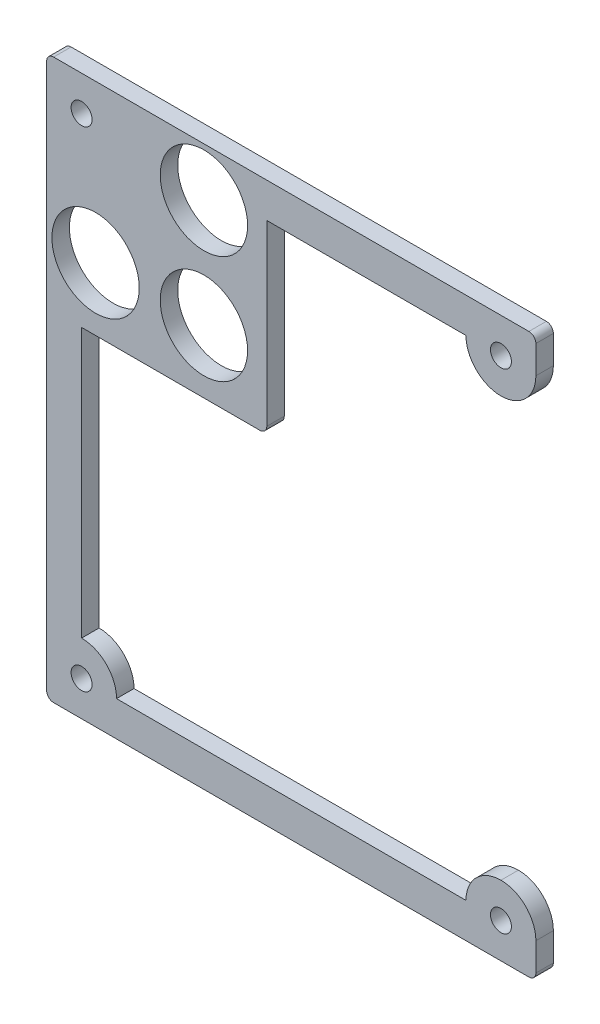
from build123d import *

# Parameters (mm, degrees)
MODEL_R             = 12.5
MODEL_R_2           = 3
BOSS_EXTRUDE2_DEPTH = 5
FILLET1_R           = 10
FILLET2_R           = 10


with BuildPart() as part:
    # Model → Boss-Extrude2 (new body)
    with BuildSketch(Plane.XY):
        with BuildLine():
            Line((140, 140), (140, 158))
            ThreePointArc((140, 158), (139.414213562, 159.414213562), (138, 160))
            Line((138, 160), (2, 160))
            ThreePointArc((2, 160), (0.585786438, 159.414213562), (0, 158))
            Line((0, 158), (0, 2))
            ThreePointArc((0, 2), (0.585786438, 0.585786438), (2, 0))
            Line((2, 0), (138, 0))
            ThreePointArc((138, 0), (139.414213562, 0.585786438), (140, 2))
            Line((140, 2), (140, 20))
            Line((140, 20), (130, 20))
            ThreePointArc((130, 20), (122.928932188, 17.071067812), (120, 10))
            Line((120, 10), (20, 10))
            ThreePointArc((20, 10), (17.071067812, 17.071067812), (10, 20))
            Line((10, 20), (10, 97))
            Line((10, 97), (61, 97))
            ThreePointArc((61, 97), (62.414213562, 97.585786438), (63, 99))
            Line((63, 99), (63, 150))
            Line((63, 150), (120, 150))
            ThreePointArc((120, 150), (122.928932188, 142.928932188), (130, 140))
            Line((130, 140), (140, 140))
        make_face()
        with Locations((14, 115)):
            Circle(MODEL_R, mode=Mode.SUBTRACT)
        with Locations((45, 115)):
            Circle(MODEL_R, mode=Mode.SUBTRACT)
        with Locations((45, 146)):
            Circle(MODEL_R, mode=Mode.SUBTRACT)
        with Locations((10, 10)):
            Circle(MODEL_R_2, mode=Mode.SUBTRACT)
        with Locations((130, 10)):
            Circle(MODEL_R_2, mode=Mode.SUBTRACT)
        with Locations((130, 150)):
            Circle(MODEL_R_2, mode=Mode.SUBTRACT)
        with Locations((10, 150)):
            Circle(MODEL_R_2, mode=Mode.SUBTRACT)
    extrude(amount=BOSS_EXTRUDE2_DEPTH)

    # Fillet1
    fillet1_edges = [part.edges().sort_by_distance(p)[0] for p in [
        (140, 20, 2.5),
    ]]
    fillet(fillet1_edges, radius=FILLET1_R - 0.0001)  # a hair under: the kernel refuses the full size

    # Fillet2
    fillet2_edges = [part.edges().sort_by_distance(p)[0] for p in [
        (140, 140, 2.5),
    ]]
    fillet(fillet2_edges, radius=FILLET2_R - 0.0001)  # a hair under: the kernel refuses the full size


solid = part.part
